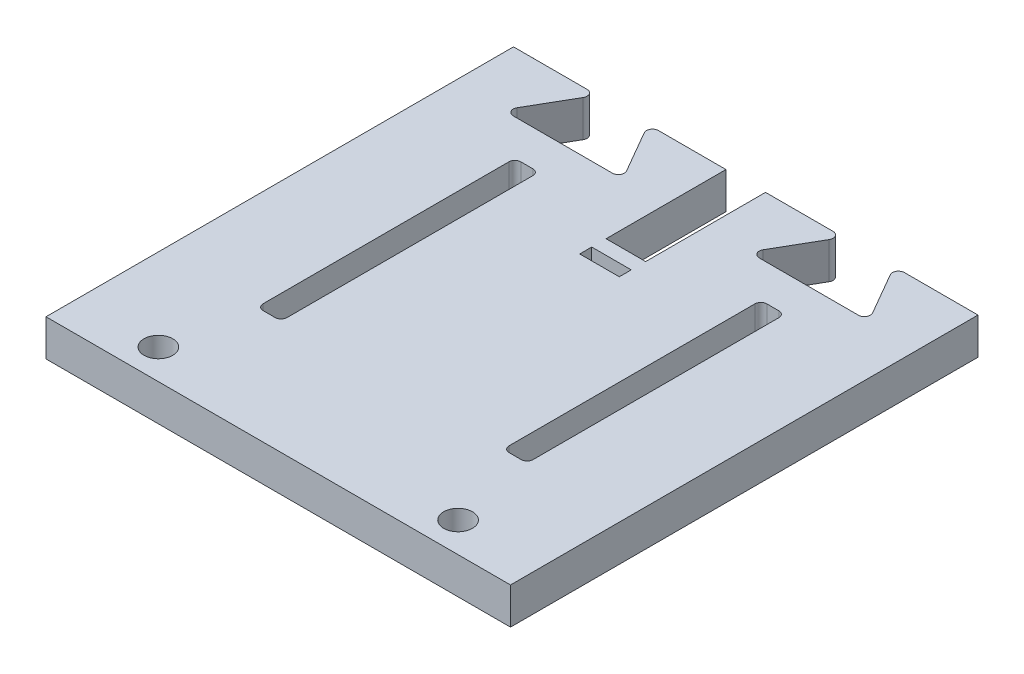
from build123d import *

# Parameters (mm, degrees)
BOSS_EXTRUDE1_DEPTH                = 3.05
FILLET3_R                          = 0.5
SKETCH2_W                          = 3.3
SKETCH2_H                          = 47
SKETCH2_H_2                        = 1
CUT_EXTRUDE1_DEPTH                 = 44.654245212
SKETCH6_W                          = 2
SKETCH6_H                          = 21.5
CUT_EXTRUDE2_DEPTH                 = 44.654245212
FILLET4_R                          = 0.5
M3_CLEARANCE_HEAD_MOUNTING_HOLES_D = 2.4


with BuildPart() as part:
    # Sketch1 → Boss-Extrude1 (new body)
    with BuildSketch(Plane(origin=(0, 0, 0), x_dir=(1, 0, 0), z_dir=(0, 1, 0))):
        Polygon((-19.375, 0), (-19.375, 39), (-12.375, 39), (-15.261751346, 34), (-5.261751346, 34), (-8.148502692, 39), (8.148502692, 39), (5.261751346, 34), (15.261751346, 34), (12.375, 39), (19.375, 39), (19.375, 0), align=None)
    extrude(amount=BOSS_EXTRUDE1_DEPTH)

    # Fillet3
    fillet3_edges = [part.edges().sort_by_distance(p)[0] for p in [
        (15.261751346, 1.525, -34),
        (12.375, 1.525, -39),
        (5.261751346, 1.525, -34),
        (8.148502692, 1.525, -39),
        (-8.148502692, 1.525, -39),
        (-5.261751346, 1.525, -34),
        (-15.261751346, 1.525, -34),
        (-12.375, 1.525, -39),
    ]]
    fillet(fillet3_edges, radius=FILLET3_R)

    # Sketch2 → Cut-Extrude1 (cut, through all)
    with BuildSketch(Plane(origin=(0, 3.05, 0), x_dir=(1, 0, 0), z_dir=(0, 1, 0))):
        with Locations((0, 52.5)):
            Rectangle(SKETCH2_W, SKETCH2_H)
        with Locations((0, 27.3)):
            Rectangle(SKETCH2_W, SKETCH2_H_2)
    extrude(amount=-CUT_EXTRUDE1_DEPTH, mode=Mode.SUBTRACT)

    # Sketch6 → Cut-Extrude2 (cut, through all)
    with BuildSketch(Plane(origin=(0, 3.05, 0), x_dir=(1, 0, 0), z_dir=(0, 1, 0))):
        with Locations((-10.261751346, 20.25)):
            Rectangle(SKETCH6_W, SKETCH6_H)
        with Locations((10.261751346, 20.25)):
            Rectangle(SKETCH6_W, SKETCH6_H)
    extrude(amount=-CUT_EXTRUDE2_DEPTH, mode=Mode.SUBTRACT)

    # Fillet4
    fillet4_edges = [part.edges().sort_by_distance(p)[0] for p in [
        (9.261751346, 1.525, -9.5),
        (11.261751346, 1.525, -9.5),
        (11.261751346, 1.525, -31),
        (9.261751346, 1.525, -31),
        (-11.261751346, 1.525, -9.5),
        (-9.261751346, 1.525, -9.5),
        (-9.261751346, 1.525, -31),
        (-11.261751346, 1.525, -31),
    ]]
    fillet(fillet4_edges, radius=FILLET4_R)

    # M3 Clearance Head Mounting Holes (through all)
    with Locations(Plane(origin=(0, 3.05, 0), x_dir=(1, 0, 0), z_dir=(0, 1, 0))):
        with Locations((-12.5, 2.5), (12.5, 2.5)):
            Hole(M3_CLEARANCE_HEAD_MOUNTING_HOLES_D / 2)


solid = part.part
